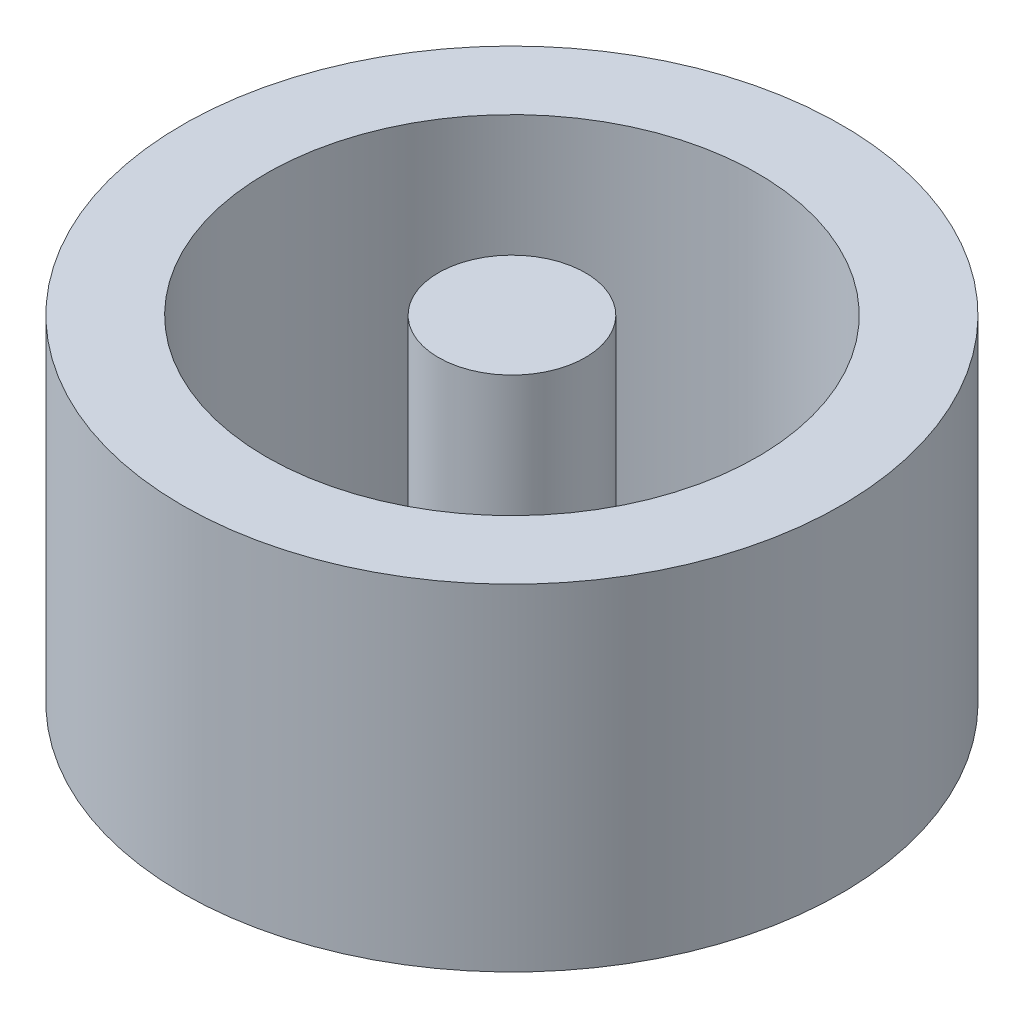
from build123d import *

# Parameters (mm, degrees)
SKETCH1_R             = 0.875
BOSS_EXTRUDE1_DEPTH   = 4
SKETCH1_R_2           = 3.925
SKETCH1_R_3           = 2.924999992
BOSS_EXTRUDE1_2_DEPTH = 4


with BuildPart() as part:
    # Sketch1 → Boss-Extrude1 (new body)
    with BuildSketch(Plane(origin=(0, 0, 0), x_dir=(1, 0, 0), z_dir=(0, 1, 0))):
        Circle(SKETCH1_R)
    extrude(amount=BOSS_EXTRUDE1_DEPTH)


with BuildPart() as body_2:
    # Sketch1 → Boss-Extrude1 2 (new body)
    with BuildSketch(Plane(origin=(0, 0, 0), x_dir=(1, 0, 0), z_dir=(0, 1, 0))):
        Circle(SKETCH1_R_2)
        Circle(SKETCH1_R_3, mode=Mode.SUBTRACT)
    extrude(amount=BOSS_EXTRUDE1_2_DEPTH)


solid = Compound([part.part, body_2.part])
